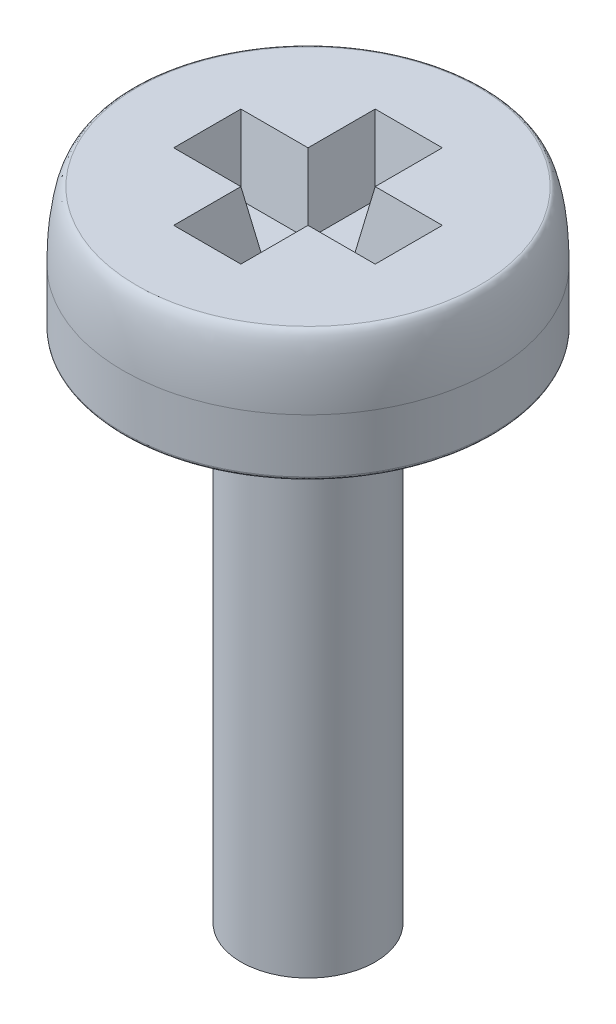
from build123d import *

# Parameters (mm, degrees)
SKETCH1_R           = 2.75
BOSS_EXTRUDE1_DEPTH = 2
FILLET1_SIZE        = 0.2
FILLET1_SIZE_2      = 1
SKETCH2_R           = 1
BOSS_EXTRUDE2_DEPTH = 7.5
CUT_EXTRUDE1_DEPTH  = 1
CUT_EXTRUDE1_DRAFT  = -10


with BuildPart() as part:
    # Sketch1 → Boss-Extrude1 (new body)
    with BuildSketch(Plane(origin=(0, 0, 0), x_dir=(1, 0, 0), z_dir=(0, 1, 0))):
        with Locations(Location((0, 0, 0), (0, 0, 270))):
            Circle(SKETCH1_R)
    extrude(amount=BOSS_EXTRUDE1_DEPTH)

    # Fillet1
    # an asymmetric fillet: 1, 0.2 mm, written as the material it takes off along each edge
    with BuildSketch(Plane(origin=(0, 0, 0), x_dir=(0, 0, 1), z_dir=(-1, 0, 0))) as fillet1_piece_1:
        with BuildLine():
            Bezier((2.75, FILLET1_SIZE), (2.75, 0), (2.75 - FILLET1_SIZE_2, 0), weights=[1, 0.707106781, 1])
            Line((2.75 - FILLET1_SIZE_2, 0), (2.75, 0))
            Line((2.75, 0), (2.75, FILLET1_SIZE))
        make_face()
    revolve(axis=Axis((0, 0, 0), (0, 1, 0)), mode=Mode.SUBTRACT)
    with BuildSketch(Plane(origin=(0, 2, 0), x_dir=(0, 0, 1), z_dir=(-1, 0, 0))) as fillet1_piece_2:
        with BuildLine():
            Bezier((2.75, -FILLET1_SIZE_2), (2.75, 0), (2.75 - FILLET1_SIZE, 0), weights=[1, 0.707106781, 1])
            Line((2.75 - FILLET1_SIZE, 0), (2.75, 0))
            Line((2.75, 0), (2.75, -FILLET1_SIZE_2))
        make_face()
    revolve(axis=Axis((0, 2, 0), (0, 1, 0)), mode=Mode.SUBTRACT)

    # Sketch2 → Boss-Extrude2 (add)
    with BuildSketch(Plane.XZ):
        with Locations(Location((0, 0, 0), (0, 0, 90))):
            Circle(SKETCH2_R)
    extrude(amount=BOSS_EXTRUDE2_DEPTH)


with BuildPart() as cut_extrude1_tool:
    # Sketch5 → Cut-Extrude1 (with draft: the straight prism first)
    with BuildSketch(Plane(origin=(0, 2, 0), x_dir=(1, 0, 0), z_dir=(0, 1, 0))):
        Polygon((0.5, 0.5), (0.5, 1.5), (-0.5, 1.5), (-0.5, 0.5), (-1.5, 0.5), (-1.5, -0.5), (-0.5, -0.5), (-0.5, -1.5), (0.5, -1.5), (0.5, -0.5), (1.5, -0.5), (1.5, 0.5), align=None)
    extrude(amount=-CUT_EXTRUDE1_DEPTH)
    # Cut-Extrude1: the draft: its side faces are tilted about the plane it starts from
    cut_extrude1_sides = [cut_extrude1_tool.faces().sort_by_distance(p)[0] for p in [
        (0.5, 1.5, -1),
        (0, 1.5, -1.5),
        (-0.5, 1.5, -1),
        (-1, 1.5, -0.5),
        (-1.5, 1.5, 0),
        (-1, 1.5, 0.5),
        (-0.5, 1.5, 1),
        (0, 1.5, 1.5),
        (0.5, 1.5, 1),
        (1, 1.5, 0.5),
        (1.5, 1.5, 0),
        (1, 1.5, -0.5),
    ]]
    draft(cut_extrude1_sides, Plane(origin=(0, 2, 0), x_dir=(1, 0, 0), z_dir=(0, 1, 0)), CUT_EXTRUDE1_DRAFT)


with BuildPart() as part_1:
    add(part.part)

    # Cut-Extrude1: cut by cut_extrude1_tool
    add(cut_extrude1_tool.part, mode=Mode.SUBTRACT)


solid = part_1.part
